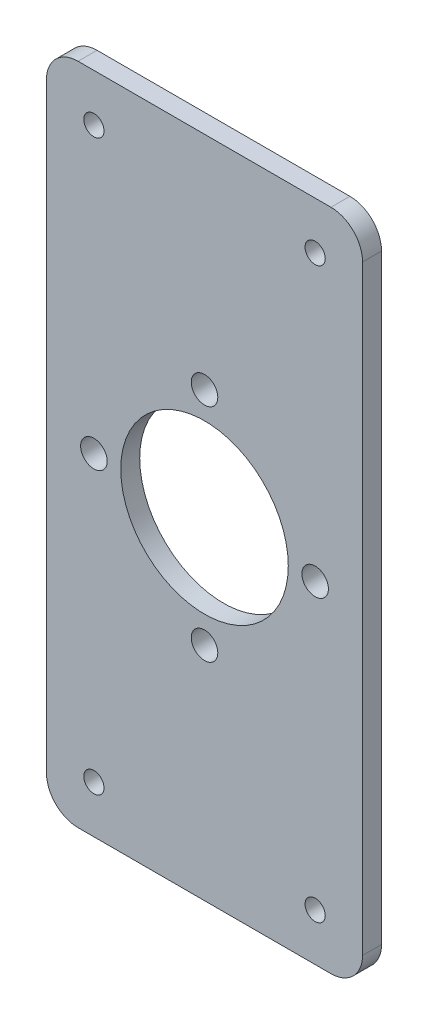
from build123d import *

# Parameters (mm, degrees)
SKETCH_2_W      = 50
SKETCH_2_H      = 105
SKETCH_2_R      = 13.25
SKETCH_2_R_2    = 2.1
SKETCH_2_R_3    = 1.6
EXTRUDE_1_DEPTH = 3
FILLET_1_R      = 5


with BuildPart() as part:
    # ｽｹｯﾁ2 → ﾎﾞｽ - 押し出し1 (new body)
    with BuildSketch(Plane.XY):
        with Locations((25, 52.5)):
            Rectangle(SKETCH_2_W, SKETCH_2_H)
        with Locations((25, 52.5)):
            Circle(SKETCH_2_R, mode=Mode.SUBTRACT)
        with Locations((25, 70)):
            Circle(SKETCH_2_R_2, mode=Mode.SUBTRACT)
        with Locations((42.5, 52.5)):
            Circle(SKETCH_2_R_2, mode=Mode.SUBTRACT)
        with Locations((7.5, 52.5)):
            Circle(SKETCH_2_R_2, mode=Mode.SUBTRACT)
        with Locations((25, 35)):
            Circle(SKETCH_2_R_2, mode=Mode.SUBTRACT)
        with Locations((7.5, 97.5)):
            Circle(SKETCH_2_R_3, mode=Mode.SUBTRACT)
        with Locations((42.5, 97.5)):
            Circle(SKETCH_2_R_3, mode=Mode.SUBTRACT)
        with Locations((42.5, 7.5)):
            Circle(SKETCH_2_R_3, mode=Mode.SUBTRACT)
        with Locations((7.5, 7.5)):
            Circle(SKETCH_2_R_3, mode=Mode.SUBTRACT)
    extrude(amount=EXTRUDE_1_DEPTH)

    # ﾌｨﾚｯﾄ1
    fillet_1_edges = [part.edges().sort_by_distance(p)[0] for p in [
        (0, 0, 1.5),
        (50, 0, 1.5),
        (0, 105, 1.5),
        (50, 105, 1.5),
    ]]
    fillet(fillet_1_edges, radius=FILLET_1_R)


solid = part.part
